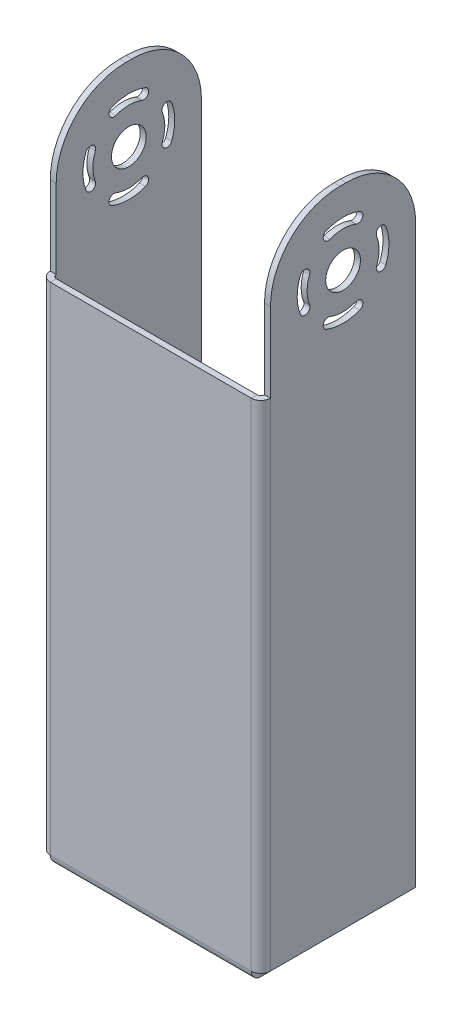
from build123d import *

# Parameters (mm, degrees)
SKETCH_1_W                  = 40.5
SKETCH_1_H                  = 100
SM_BASE_FLANGE_1_DEPTH      = 1.2
SM_EDGE_FLANGE_1_DEPTH      = 100
SM_EDGE_FLANGE_1_BEND_DEPTH = 100
SM_EDGE_FLANGE_3_DEPTH      = 40.5
SKETCH_25_R                 = 1.5
CUT_EXTRUDE_1_DEPTH         = 10
SKETCH_26_W                 = 1.2
SKETCH_26_H                 = 29.2634
EXTRUDE_1_DEPTH             = 30
SKETCH_29_R                 = 3.5
CUT_EXTRUDE_2_DEPTH         = 87
FILLET_1_R                  = 14


# Sheet-metal steps are written as plain solids
with BuildPart() as part:
    # Sketch 1 → 基材-凸緣1 (new body)
    with BuildSketch(Plane.XY):
        with Locations((-29.069965263, -8.639189189)):
            Rectangle(SKETCH_1_W, SKETCH_1_H)
    extrude(amount=-SM_BASE_FLANGE_1_DEPTH)

    # 邊線-凸緣1 section (across the edge) → 邊線-凸緣1 (add)
    with BuildSketch(Plane(origin=(-8.083365263, 41.360810811, -1.2), x_dir=(-1, 0, 0), z_dir=(0, -1, 0))):
        with BuildLine():
            Line((-1.2, 0.7366), (-1.2, 30))
            Line((-1.2, 30), (0, 30))
            Line((0, 30), (0, 0.7366))
            ThreePointArc((0, 0.7366), (0.215745145, 0.215745145), (0.7366, 0))
            Line((0.7366, 0), (0.7366, -1.2))
            ThreePointArc((0.7366, -1.2), (-0.632782992, -0.632782992), (-1.2, 0.7366))
        make_face()
    extrude(amount=SM_EDGE_FLANGE_1_DEPTH)

    # 邊線-凸緣1 section 2 (across the edge) → 邊線-凸緣1 bend (add)
    with BuildSketch(Plane(origin=(-50.056565263, -58.639189189, -1.2), x_dir=(1, 0, 0), z_dir=(0, 1, 0))):
        with BuildLine():
            Line((-1.2, 0.7366), (-1.2, 30))
            Line((-1.2, 30), (0, 30))
            Line((0, 30), (0, 0.7366))
            ThreePointArc((0, 0.7366), (0.215745145, 0.215745145), (0.7366, 0))
            Line((0.7366, 0), (0.7366, -1.2))
            ThreePointArc((0.7366, -1.2), (-0.632782992, -0.632782992), (-1.2, 0.7366))
        make_face()
    extrude(amount=SM_EDGE_FLANGE_1_BEND_DEPTH)

    # 邊線-凸緣3 section (across the edge) → 邊線-凸緣3 (add)
    with BuildSketch(Plane(origin=(-8.819965263, -59.375789189, -1.2), x_dir=(0, 1, 0), z_dir=(-1, 0, 0))):
        with BuildLine():
            Line((-1.2, 0.7366), (-1.2, 20.735))
            Line((-1.2, 20.735), (0, 20.735))
            Line((0, 20.735), (0, 0.7366))
            ThreePointArc((0, 0.7366), (0.215745145, 0.215745145), (0.7366, 0))
            Line((0.7366, 0), (0.7366, -1.2))
            ThreePointArc((0.7366, -1.2), (-0.632782992, -0.632782992), (-1.2, 0.7366))
        make_face()
    extrude(amount=SM_EDGE_FLANGE_3_DEPTH)

    # 草圖25 → 除料-伸長1 (cut)
    with BuildSketch(Plane.XZ.offset(60.575789189)):
        with Locations(Location((-43.579965263, -6.9366, 0), (0, 0, 270))):
            Circle(SKETCH_25_R)
        with Locations(Location((-43.579965263, -16.935, 0), (0, 0, 90))):
            Circle(SKETCH_25_R)
        with Locations(Location((-14.559965263, -16.935, 0), (0, 0, 270))):
            Circle(SKETCH_25_R)
        with Locations(Location((-14.559965263, -6.9366, 0), (0, 0, 90))):
            Circle(SKETCH_25_R)
    extrude(amount=-CUT_EXTRUDE_1_DEPTH, mode=Mode.SUBTRACT)

    # 草圖26 → 填料-伸長1 (add)
    with BuildSketch(Plane(origin=(0, 41.360810811, 0), x_dir=(1, 0, 0), z_dir=(0, 1, 0))):
        with Locations((-50.656565263, 16.5683)):
            Rectangle(SKETCH_26_W, SKETCH_26_H)
        with Locations((-7.483365263, 16.5683)):
            Rectangle(SKETCH_26_W, SKETCH_26_H)
    extrude(amount=EXTRUDE_1_DEPTH)

    # 草圖29 → 除料-伸長2 (cut)
    with BuildSketch(Plane(origin=(-6.883365263, 0, 0), x_dir=(0, 0, -1), z_dir=(1, 0, 0))):
        with Locations((16.5683, 56.360810811)):
            Circle(SKETCH_29_R)
        with BuildLine():
            ThreePointArc((25.185054053, 52.997174447), (25.8183, 56.360810811), (25.185054053, 59.724447174))
            ThreePointArc((25.185054053, 59.724447174), (23.889876711, 60.29235179), (23.321972096, 58.997174447))
            ThreePointArc((23.321972096, 58.997174447), (23.8183, 56.360810811), (23.321972096, 53.724447174))
            ThreePointArc((23.321972096, 53.724447174), (23.889876711, 52.429269832), (25.185054053, 52.997174447))
        make_face()
        with BuildLine():
            ThreePointArc((13.204663636, 64.977564864), (12.636759021, 63.682387522), (13.931936364, 63.114482907))
            ThreePointArc((13.931936364, 63.114482907), (16.5683, 63.610810811), (19.204663636, 63.114482907))
            ThreePointArc((19.204663636, 63.114482907), (20.499840979, 63.682387522), (19.931936364, 64.977564864))
            ThreePointArc((19.931936364, 64.977564864), (16.5683, 65.610810811), (13.204663636, 64.977564864))
        make_face()
        with BuildLine():
            ThreePointArc((13.204663636, 47.744056758), (16.5683, 47.110810811), (19.931936364, 47.744056758))
            ThreePointArc((19.931936364, 47.744056758), (20.499840979, 49.0392341), (19.204663636, 49.607138715))
            ThreePointArc((19.204663636, 49.607138715), (16.5683, 49.110810811), (13.931936364, 49.607138715))
            ThreePointArc((13.931936364, 49.607138715), (12.636759021, 49.0392341), (13.204663636, 47.744056758))
        make_face()
        with BuildLine():
            ThreePointArc((7.951545947, 59.724447174), (7.3183, 56.360810811), (7.951545947, 52.997174447))
            ThreePointArc((7.951545947, 52.997174447), (9.246723289, 52.429269832), (9.814627904, 53.724447174))
            ThreePointArc((9.814627904, 53.724447174), (9.3183, 56.360810811), (9.814627904, 58.997174447))
            ThreePointArc((9.814627904, 58.997174447), (9.246723289, 60.29235179), (7.951545947, 59.724447174))
        make_face()
    extrude(amount=-CUT_EXTRUDE_2_DEPTH, mode=Mode.SUBTRACT)

    # 圓角1
    fillet_1_edges = [part.edges().sort_by_distance(p)[0] for p in [
        (-50.656565263, 71.360810811, -31.2),
        (-50.656565263, 71.360810811, -1.9366),
        (-7.483365263, 71.360810811, -31.2),
        (-7.483365263, 71.360810811, -1.9366),
    ]]
    fillet(fillet_1_edges, radius=FILLET_1_R)


solid = part.part
